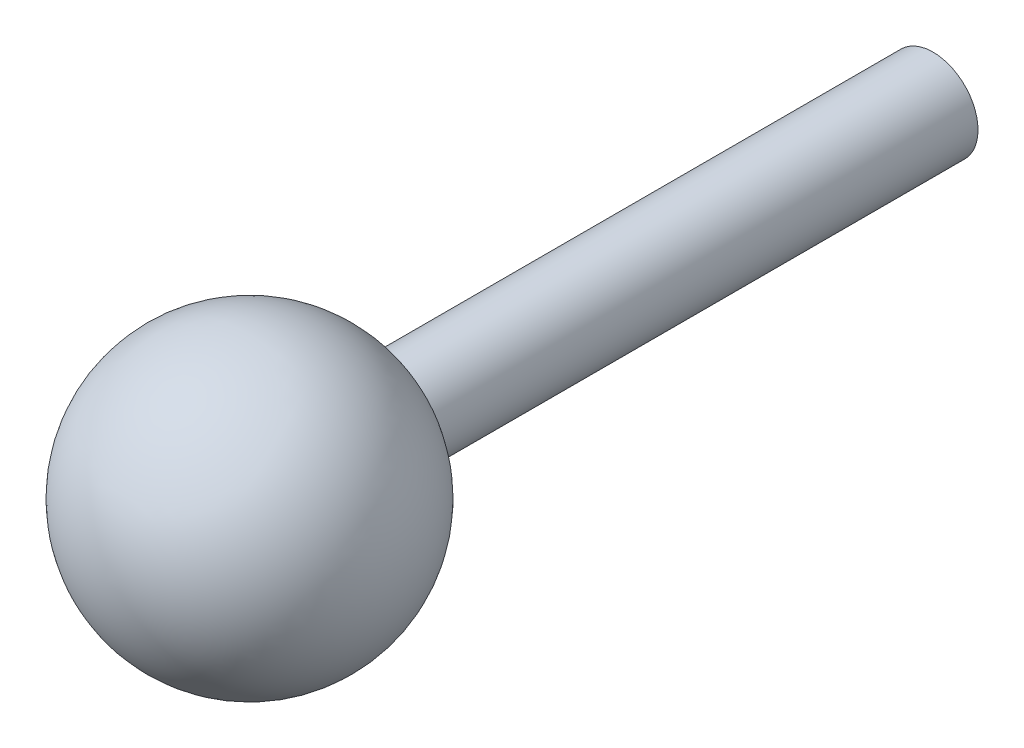
from build123d import *

# Parameters (mm, degrees)
SKETCH1_R           = 1.25
BOSS_EXTRUDE1_DEPTH = 19


with BuildPart() as part:
    # Sketch1 → Boss-Extrude1 (new body)
    with BuildSketch(Plane.XY):
        Circle(SKETCH1_R)
    extrude(amount=BOSS_EXTRUDE1_DEPTH)

    # Sketch2 → Revolve1 (revolve)
    with BuildSketch(Plane.XY.offset(19)):
        with BuildLine():
            ThreePointArc((0, 4), (-4, 0), (0, -4))
            Line((0, -4), (0, -1.25))
            ThreePointArc((0, -1.25), (-1.25, 0), (0, 1.25))
            Line((0, 1.25), (0, 4))
        make_face()
    revolve(axis=Axis((0, -4, 19), (0, 1, 0)))


solid = part.part
